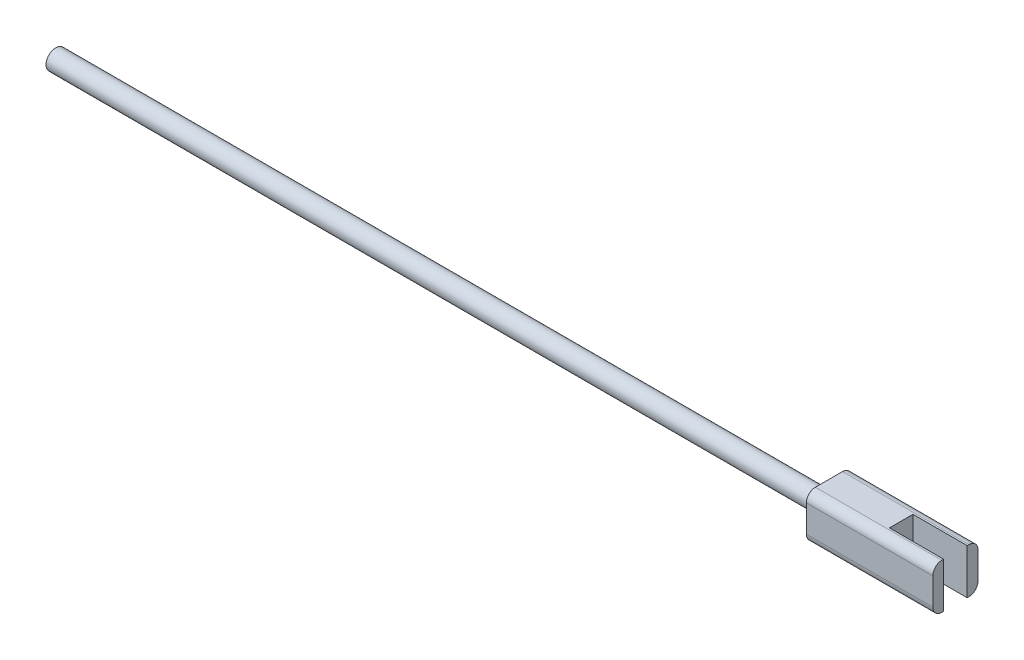
from build123d import *

# Parameters (mm, degrees)
SKETCH1_R               = 1.09
BOSS_EXTRUDE1_DEPTH     = 87.575
BOSS_EXTRUDE2_DEPTH     = 14
CUT_EXTRUDE1_DEPTH      = 100.637746989
CUT_EXTRUDE1_DEPTH_BACK = 100.637746989
SKETCH3_W               = 7
SKETCH3_H               = 2.6


with BuildPart() as part:
    # Sketch1 → Boss-Extrude1 (new body)
    with BuildSketch(Plane(origin=(0, 0, 0), x_dir=(0, 0, -1), z_dir=(1, 0, 0))):
        Circle(SKETCH1_R)
    extrude(amount=BOSS_EXTRUDE1_DEPTH)

    # Sketch2 → Boss-Extrude2 (add)
    with BuildSketch(Plane(origin=(85.575, 0, 0), x_dir=(0, 0, -1), z_dir=(1, 0, 0))):
        with BuildLine():
            Line((-1.5, -2.5), (1.5, -2.5))
            ThreePointArc((1.5, -2.5), (2.207106781, -2.207106781), (2.5, -1.5))
            Line((2.5, -1.5), (2.5, 1.5))
            ThreePointArc((2.5, 1.5), (2.207106781, 2.207106781), (1.5, 2.5))
            Line((1.5, 2.5), (-1.5, 2.5))
            ThreePointArc((-1.5, 2.5), (-2.207106781, 2.207106781), (-2.5, 1.5))
            Line((-2.5, 1.5), (-2.5, -1.5))
            ThreePointArc((-2.5, -1.5), (-2.207106781, -2.207106781), (-1.5, -2.5))
        make_face()
    extrude(amount=BOSS_EXTRUDE2_DEPTH)

    # Sketch3 → Cut-Extrude1 (cut, two sides: drawn at the far end of the back side and taken through both)
    with BuildSketch(Plane(origin=(0, 0, 0), x_dir=(1, 0, 0), z_dir=(0, 1, 0)).offset(-CUT_EXTRUDE1_DEPTH_BACK)):
        with Locations((97.075, 0)):
            Rectangle(SKETCH3_W, SKETCH3_H)
    extrude(amount=CUT_EXTRUDE1_DEPTH + CUT_EXTRUDE1_DEPTH_BACK, mode=Mode.SUBTRACT)


solid = part.part
